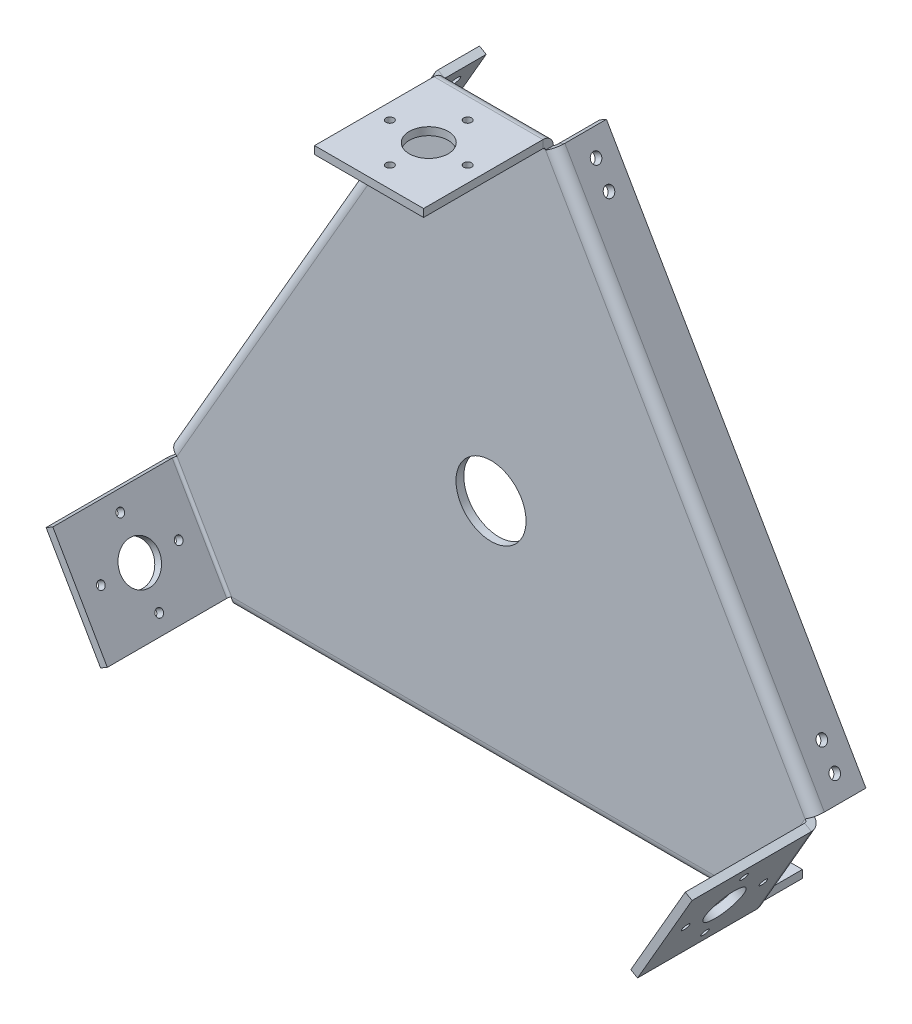
from build123d import *

# Parameters (mm, degrees)
SM_BASE_FLANGE_3_DEPTH        = 3
SM_EDGE_FLANGE_2_DEPTH        = 42
SM_EDGE_FLANGE_2_BEND_DEPTH   = 42
SM_EDGE_FLANGE_2_BEND_2_DEPTH = 42
SM_EDGE_FLANGE_6_DEPTH        = 200
SM_EDGE_FLANGE_6_BEND_DEPTH   = 200
SM_EDGE_FLANGE_6_BEND_2_DEPTH = 200
CUT_EXTRUDE_3_REACH           = 318.122
SKETCH_42_R                   = 7.5
SKETCH_42_R_2                 = 1.5
CUT_EXTRUDE_2_REACH           = 355.809
SKETCH_43_R                   = 7.5
SKETCH_43_R_2                 = 1.5
CUT_EXTRUDE_1_REACH           = 319.229
SKETCH_44_R                   = 7.5
SKETCH_44_R_2                 = 1.5
CUT_EXTRUDE_4_REACH           = 328.974
SKETCH_47_R                   = 2
CUT_EXTRUDE_6_REACH           = 243.544
SKETCH_50_R                   = 2
CUT_EXTRUDE_7_REACH           = 318.122
SKETCH_51_R                   = 2
CUT_EXTRUDE_8_REACH           = 315.847
SKETCH_52_R                   = 13.5


# Sheet-metal steps are written as plain solids
with BuildPart() as part:
    # Эскиз10 → Базовая кромка3 (new body)
    with BuildSketch(Plane.XY):
        Polygon((0, 0), (-21, 36.373066959), (79, 209.578147716), (121, 209.578147716), (221, 36.373066959), (200, 0), align=None)
    extrude(amount=-SM_BASE_FLANGE_3_DEPTH)

    # Ребро-кромка2 section (across the edge) → Ребро-кромка2 (add)
    with BuildSketch(Plane(origin=(121, 210.578147716, 0), x_dir=(0, -1, 0), z_dir=(-1, 0, 0))):
        with BuildLine():
            Line((-3, 1), (-3, 47))
            Line((-3, 47), (0, 47))
            Line((0, 47), (0, 1))
            ThreePointArc((0, 1), (0.292893219, 0.292893219), (1, 0))
            Line((1, 0), (1, -3))
            ThreePointArc((1, -3), (-1.828427125, -1.828427125), (-3, 1))
        make_face()
    extrude(amount=SM_EDGE_FLANGE_2_DEPTH)

    # Ребро-кромка2 section 2 (across the edge) → Ребро-кромка2 bend (add)
    with BuildSketch(Plane(origin=(-21.866025404, 35.873066959, 0), x_dir=(0.8660254037844359, 0.5000000000000049, 3.4914813388431326e-15), z_dir=(0.5000000000000049, -0.8660254037844359, 0))):
        with BuildLine():
            Line((-3, 1), (-3, 47))
            Line((-3, 47), (0, 47))
            Line((0, 47), (0, 1))
            ThreePointArc((0, 1), (0.292893219, 0.292893219), (1, 0))
            Line((1, 0), (1, -3))
            ThreePointArc((1, -3), (-1.828427125, -1.828427125), (-3, 1))
        make_face()
    extrude(amount=SM_EDGE_FLANGE_2_BEND_DEPTH)

    # Ребро-кромка2 section 3 (across the edge) → Ребро-кромка2 bend 2 (add)
    with BuildSketch(Plane(origin=(200.866025404, -0.5, 0), x_dir=(-0.8660254037844527, 0.49999999999997596, 3.4914813388431334e-15), z_dir=(0.49999999999997596, 0.8660254037844527, 0))):
        with BuildLine():
            Line((-3, 1), (-3, 47))
            Line((-3, 47), (0, 47))
            Line((0, 47), (0, 1))
            ThreePointArc((0, 1), (0.292893219, 0.292893219), (1, 0))
            Line((1, 0), (1, -3))
            ThreePointArc((1, -3), (-1.828427125, -1.828427125), (-3, 1))
        make_face()
    extrude(amount=SM_EDGE_FLANGE_2_BEND_2_DEPTH)

    # Ребро-кромка6 section (across the edge) → Ребро-кромка6 (add)
    with BuildSketch(Plane(origin=(-21.866025404, 36.873066959, -3), x_dir=(0.8660254037844431, -0.4999999999999925, -3.4914813388431334e-15), z_dir=(0.4999999999999925, 0.8660254037844431, 0))):
        with BuildLine():
            Line((-3, 1), (-3, 17))
            Line((-3, 17), (0, 17))
            Line((0, 17), (0, 1))
            ThreePointArc((0, 1), (0.292893219, 0.292893219), (1, 0))
            Line((1, 0), (1, -3))
            ThreePointArc((1, -3), (-1.828427125, -1.828427125), (-3, 1))
        make_face()
    extrude(amount=SM_EDGE_FLANGE_6_DEPTH)

    # Ребро-кромка6 section 2 (across the edge) → Ребро-кромка6 bend (add)
    with BuildSketch(Plane(origin=(121.866025404, 210.078147716, -3), x_dir=(-0.8660254037844359, -0.5000000000000047, -3.4914813388431334e-15), z_dir=(0.5000000000000047, -0.8660254037844359, 0))):
        with BuildLine():
            Line((-3, 1), (-3, 17))
            Line((-3, 17), (0, 17))
            Line((0, 17), (0, 1))
            ThreePointArc((0, 1), (0.292893219, 0.292893219), (1, 0))
            Line((1, 0), (1, -3))
            ThreePointArc((1, -3), (-1.828427125, -1.828427125), (-3, 1))
        make_face()
    extrude(amount=SM_EDGE_FLANGE_6_BEND_DEPTH)

    # Ребро-кромка6 section 3 (across the edge) → Ребро-кромка6 bend 2 (add)
    with BuildSketch(Plane(origin=(200, -1, -3), x_dir=(0, 1, 0), z_dir=(-1, 0, 0))):
        with BuildLine():
            Line((-3, 1), (-3, 17))
            Line((-3, 17), (0, 17))
            Line((0, 17), (0, 1))
            ThreePointArc((0, 1), (0.292893219, 0.292893219), (1, 0))
            Line((1, 0), (1, -3))
            ThreePointArc((1, -3), (-1.828427125, -1.828427125), (-3, 1))
        make_face()
    extrude(amount=SM_EDGE_FLANGE_6_BEND_2_DEPTH)

    # Эскиз42 → Вырез-Вытянуть3 (cut, up to next)
    with BuildSketch(Plane(origin=(0, 213.578147716, 0), x_dir=(1, 0, 0), z_dir=(0, 1, 0)), mode=Mode.PRIVATE) as cut_extrude_3_sk1:
        with Locations(Location((100, -24, 0), (0, 0, 180))):
            Circle(SKETCH_42_R)
    cut_extrude_3_tool1 = extrude(cut_extrude_3_sk1.sketch, amount=-CUT_EXTRUDE_3_REACH, mode=Mode.PRIVATE) & part.part
    # Эскиз42 → Вырез-Вытянуть3 (cut, up to next)
    with BuildSketch(Plane(origin=(0, 213.578147716, 0), x_dir=(1, 0, 0), z_dir=(0, 1, 0)), mode=Mode.PRIVATE) as cut_extrude_3_sk2:
        with Locations(Location((100, -9, 0), (0, 0, 180))):
            Circle(SKETCH_42_R_2)
    cut_extrude_3_tool2 = extrude(cut_extrude_3_sk2.sketch, amount=-CUT_EXTRUDE_3_REACH, mode=Mode.PRIVATE) & part.part
    # Эскиз42 → Вырез-Вытянуть3 (cut, up to next)
    with BuildSketch(Plane(origin=(0, 213.578147716, 0), x_dir=(1, 0, 0), z_dir=(0, 1, 0)), mode=Mode.PRIVATE) as cut_extrude_3_sk3:
        with Locations(Location((115, -24, 0), (0, 0, 180))):
            Circle(SKETCH_42_R_2)
    cut_extrude_3_tool3 = extrude(cut_extrude_3_sk3.sketch, amount=-CUT_EXTRUDE_3_REACH, mode=Mode.PRIVATE) & part.part
    # Эскиз42 → Вырез-Вытянуть3 (cut, up to next)
    with BuildSketch(Plane(origin=(0, 213.578147716, 0), x_dir=(1, 0, 0), z_dir=(0, 1, 0)), mode=Mode.PRIVATE) as cut_extrude_3_sk4:
        with Locations(Location((100, -39, 0), (0, 0, 180))):
            Circle(SKETCH_42_R_2)
    cut_extrude_3_tool4 = extrude(cut_extrude_3_sk4.sketch, amount=-CUT_EXTRUDE_3_REACH, mode=Mode.PRIVATE) & part.part
    # Эскиз42 → Вырез-Вытянуть3 (cut, up to next)
    with BuildSketch(Plane(origin=(0, 213.578147716, 0), x_dir=(1, 0, 0), z_dir=(0, 1, 0)), mode=Mode.PRIVATE) as cut_extrude_3_sk5:
        with Locations(Location((85, -24, 0), (0, 0, 180))):
            Circle(SKETCH_42_R_2)
    cut_extrude_3_tool5 = extrude(cut_extrude_3_sk5.sketch, amount=-CUT_EXTRUDE_3_REACH, mode=Mode.PRIVATE) & part.part
    add(cut_extrude_3_tool1.solids().sort_by_distance((100, 213.578148, 24))[0], mode=Mode.SUBTRACT)
    add(cut_extrude_3_tool2.solids().sort_by_distance((100, 213.578148, 9))[0], mode=Mode.SUBTRACT)
    add(cut_extrude_3_tool3.solids().sort_by_distance((115, 213.578148, 24))[0], mode=Mode.SUBTRACT)
    add(cut_extrude_3_tool4.solids().sort_by_distance((100, 213.578148, 39))[0], mode=Mode.SUBTRACT)
    add(cut_extrude_3_tool5.solids().sort_by_distance((85, 213.578148, 24))[0], mode=Mode.SUBTRACT)

    # Эскиз43 → Вырез-Вытянуть2 (cut, up to next)
    with BuildSketch(Plane(origin=(153.464101615, -88.602540378, 0), x_dir=(0, 0, -1), z_dir=(0.8660254037844525, -0.4999999999999761, -3.3549385599670306e-15)), mode=Mode.PRIVATE) as cut_extrude_2_sk1:
        with Locations(Location((-24, 121, 0), (0, 0, 90))):
            Circle(SKETCH_43_R)
    cut_extrude_2_tool1 = extrude(cut_extrude_2_sk1.sketch, amount=-CUT_EXTRUDE_2_REACH, mode=Mode.PRIVATE) & part.part
    # Эскиз43 → Вырез-Вытянуть2 (cut, up to next)
    with BuildSketch(Plane(origin=(153.464101615, -88.602540378, 0), x_dir=(0, 0, -1), z_dir=(0.8660254037844525, -0.4999999999999761, -3.3549385599670306e-15)), mode=Mode.PRIVATE) as cut_extrude_2_sk2:
        with Locations(Location((-24, 136, 0), (0, 0, 90))):
            Circle(SKETCH_43_R_2)
    cut_extrude_2_tool2 = extrude(cut_extrude_2_sk2.sketch, amount=-CUT_EXTRUDE_2_REACH, mode=Mode.PRIVATE) & part.part
    # Эскиз43 → Вырез-Вытянуть2 (cut, up to next)
    with BuildSketch(Plane(origin=(153.464101615, -88.602540378, 0), x_dir=(0, 0, -1), z_dir=(0.8660254037844525, -0.4999999999999761, -3.3549385599670306e-15)), mode=Mode.PRIVATE) as cut_extrude_2_sk3:
        with Locations(Location((-9, 121, 0), (0, 0, 90))):
            Circle(SKETCH_43_R_2)
    cut_extrude_2_tool3 = extrude(cut_extrude_2_sk3.sketch, amount=-CUT_EXTRUDE_2_REACH, mode=Mode.PRIVATE) & part.part
    # Эскиз43 → Вырез-Вытянуть2 (cut, up to next)
    with BuildSketch(Plane(origin=(153.464101615, -88.602540378, 0), x_dir=(0, 0, -1), z_dir=(0.8660254037844525, -0.4999999999999761, -3.3549385599670306e-15)), mode=Mode.PRIVATE) as cut_extrude_2_sk4:
        with Locations(Location((-24, 106, 0), (0, 0, 90))):
            Circle(SKETCH_43_R_2)
    cut_extrude_2_tool4 = extrude(cut_extrude_2_sk4.sketch, amount=-CUT_EXTRUDE_2_REACH, mode=Mode.PRIVATE) & part.part
    # Эскиз43 → Вырез-Вытянуть2 (cut, up to next)
    with BuildSketch(Plane(origin=(153.464101615, -88.602540378, 0), x_dir=(0, 0, -1), z_dir=(0.8660254037844525, -0.4999999999999761, -3.3549385599670306e-15)), mode=Mode.PRIVATE) as cut_extrude_2_sk5:
        with Locations(Location((-39, 121, 0), (0, 0, 90))):
            Circle(SKETCH_43_R_2)
    cut_extrude_2_tool5 = extrude(cut_extrude_2_sk5.sketch, amount=-CUT_EXTRUDE_2_REACH, mode=Mode.PRIVATE) & part.part
    add(cut_extrude_2_tool1.solids().sort_by_distance((213.964102, 16.186533, 24))[0], mode=Mode.SUBTRACT)
    add(cut_extrude_2_tool2.solids().sort_by_distance((221.464102, 29.176915, 24))[0], mode=Mode.SUBTRACT)
    add(cut_extrude_2_tool3.solids().sort_by_distance((213.964102, 16.186533, 9))[0], mode=Mode.SUBTRACT)
    add(cut_extrude_2_tool4.solids().sort_by_distance((206.464102, 3.196152, 24))[0], mode=Mode.SUBTRACT)
    add(cut_extrude_2_tool5.solids().sort_by_distance((213.964102, 16.186533, 39))[0], mode=Mode.SUBTRACT)

    # Эскиз44 → Вырез-Вытянуть1 (cut, up to next)
    with BuildSketch(Plane(origin=(-3.464101615, -2, 0), x_dir=(0, 0, 1), z_dir=(-0.8660254037844358, -0.500000000000005, -3.509022108555461e-15)), mode=Mode.PRIVATE) as cut_extrude_1_sk1:
        with Locations(Location((24, 21, 0), (0, 0, 270))):
            Circle(SKETCH_44_R)
    cut_extrude_1_tool1 = extrude(cut_extrude_1_sk1.sketch, amount=-CUT_EXTRUDE_1_REACH, mode=Mode.PRIVATE) & part.part
    # Эскиз44 → Вырез-Вытянуть1 (cut, up to next)
    with BuildSketch(Plane(origin=(-3.464101615, -2, 0), x_dir=(0, 0, 1), z_dir=(-0.8660254037844358, -0.500000000000005, -3.509022108555461e-15)), mode=Mode.PRIVATE) as cut_extrude_1_sk2:
        with Locations(Location((24, 36, 0), (0, 0, 270))):
            Circle(SKETCH_44_R_2)
    cut_extrude_1_tool2 = extrude(cut_extrude_1_sk2.sketch, amount=-CUT_EXTRUDE_1_REACH, mode=Mode.PRIVATE) & part.part
    # Эскиз44 → Вырез-Вытянуть1 (cut, up to next)
    with BuildSketch(Plane(origin=(-3.464101615, -2, 0), x_dir=(0, 0, 1), z_dir=(-0.8660254037844358, -0.500000000000005, -3.509022108555461e-15)), mode=Mode.PRIVATE) as cut_extrude_1_sk3:
        with Locations(Location((39, 21, 0), (0, 0, 270))):
            Circle(SKETCH_44_R_2)
    cut_extrude_1_tool3 = extrude(cut_extrude_1_sk3.sketch, amount=-CUT_EXTRUDE_1_REACH, mode=Mode.PRIVATE) & part.part
    # Эскиз44 → Вырез-Вытянуть1 (cut, up to next)
    with BuildSketch(Plane(origin=(-3.464101615, -2, 0), x_dir=(0, 0, 1), z_dir=(-0.8660254037844358, -0.500000000000005, -3.509022108555461e-15)), mode=Mode.PRIVATE) as cut_extrude_1_sk4:
        with Locations(Location((24, 6, 0), (0, 0, 270))):
            Circle(SKETCH_44_R_2)
    cut_extrude_1_tool4 = extrude(cut_extrude_1_sk4.sketch, amount=-CUT_EXTRUDE_1_REACH, mode=Mode.PRIVATE) & part.part
    # Эскиз44 → Вырез-Вытянуть1 (cut, up to next)
    with BuildSketch(Plane(origin=(-3.464101615, -2, 0), x_dir=(0, 0, 1), z_dir=(-0.8660254037844358, -0.500000000000005, -3.509022108555461e-15)), mode=Mode.PRIVATE) as cut_extrude_1_sk5:
        with Locations(Location((9, 21, 0), (0, 0, 270))):
            Circle(SKETCH_44_R_2)
    cut_extrude_1_tool5 = extrude(cut_extrude_1_sk5.sketch, amount=-CUT_EXTRUDE_1_REACH, mode=Mode.PRIVATE) & part.part
    add(cut_extrude_1_tool1.solids().sort_by_distance((-13.964102, 16.186533, 24))[0], mode=Mode.SUBTRACT)
    add(cut_extrude_1_tool2.solids().sort_by_distance((-21.464102, 29.176915, 24))[0], mode=Mode.SUBTRACT)
    add(cut_extrude_1_tool3.solids().sort_by_distance((-13.964102, 16.186533, 39))[0], mode=Mode.SUBTRACT)
    add(cut_extrude_1_tool4.solids().sort_by_distance((-6.464102, 3.196152, 24))[0], mode=Mode.SUBTRACT)
    add(cut_extrude_1_tool5.solids().sort_by_distance((-13.964102, 16.186533, 9))[0], mode=Mode.SUBTRACT)

    # Эскиз47 → Вырез-Вытянуть4 (cut, up to next)
    with BuildSketch(Plane(origin=(-34.964101615, 20.186533479, 0), x_dir=(0, 0, 1), z_dir=(-0.866025403784443, 0.4999999999999925, 3.788649256556814e-15)), mode=Mode.PRIVATE) as cut_extrude_4_sk1:
        with Locations(Location((-12, 29, 0), (0, 0, 270))):
            Circle(SKETCH_47_R)
    cut_extrude_4_tool1 = extrude(cut_extrude_4_sk1.sketch, amount=-CUT_EXTRUDE_4_REACH, mode=Mode.PRIVATE) & part.part
    # Эскиз47 → Вырез-Вытянуть4 (cut, up to next)
    with BuildSketch(Plane(origin=(-34.964101615, 20.186533479, 0), x_dir=(0, 0, 1), z_dir=(-0.866025403784443, 0.4999999999999925, 3.788649256556814e-15)), mode=Mode.PRIVATE) as cut_extrude_4_sk2:
        with Locations(Location((-12, 39, 0), (0, 0, 270))):
            Circle(SKETCH_47_R)
    cut_extrude_4_tool2 = extrude(cut_extrude_4_sk2.sketch, amount=-CUT_EXTRUDE_4_REACH, mode=Mode.PRIVATE) & part.part
    # Эскиз47 → Вырез-Вытянуть4 (cut, up to next)
    with BuildSketch(Plane(origin=(-34.964101615, 20.186533479, 0), x_dir=(0, 0, 1), z_dir=(-0.866025403784443, 0.4999999999999925, 3.788649256556814e-15)), mode=Mode.PRIVATE) as cut_extrude_4_sk3:
        with Locations(Location((-12, 203, 0), (0, 0, 270))):
            Circle(SKETCH_47_R)
    cut_extrude_4_tool3 = extrude(cut_extrude_4_sk3.sketch, amount=-CUT_EXTRUDE_4_REACH, mode=Mode.PRIVATE) & part.part
    # Эскиз47 → Вырез-Вытянуть4 (cut, up to next)
    with BuildSketch(Plane(origin=(-34.964101615, 20.186533479, 0), x_dir=(0, 0, 1), z_dir=(-0.866025403784443, 0.4999999999999925, 3.788649256556814e-15)), mode=Mode.PRIVATE) as cut_extrude_4_sk4:
        with Locations(Location((-12, 213, 0), (0, 0, 270))):
            Circle(SKETCH_47_R)
    cut_extrude_4_tool4 = extrude(cut_extrude_4_sk4.sketch, amount=-CUT_EXTRUDE_4_REACH, mode=Mode.PRIVATE) & part.part
    add(cut_extrude_4_tool1.solids().sort_by_distance((-20.464102, 45.30127, -12))[0], mode=Mode.SUBTRACT)
    add(cut_extrude_4_tool2.solids().sort_by_distance((-15.464102, 53.961524, -12))[0], mode=Mode.SUBTRACT)
    add(cut_extrude_4_tool3.solids().sort_by_distance((66.535898, 195.98969, -12))[0], mode=Mode.SUBTRACT)
    add(cut_extrude_4_tool4.solids().sort_by_distance((71.535898, 204.649944, -12))[0], mode=Mode.SUBTRACT)

    # Эскиз50 → Вырез-Вытянуть6 (cut, up to next)
    with BuildSketch(Plane(origin=(184.964101615, 106.789073858, 0), x_dir=(0, 0, -1), z_dir=(0.866025403784436, 0.5000000000000047, 3.0623287353932815e-15)), mode=Mode.PRIVATE) as cut_extrude_6_sk1:
        with Locations(Location((12, -71, 0), (0, 0, 90))):
            Circle(SKETCH_50_R)
    cut_extrude_6_tool1 = extrude(cut_extrude_6_sk1.sketch, amount=-CUT_EXTRUDE_6_REACH, mode=Mode.PRIVATE) & part.part
    # Эскиз50 → Вырез-Вытянуть6 (cut, up to next)
    with BuildSketch(Plane(origin=(184.964101615, 106.789073858, 0), x_dir=(0, 0, -1), z_dir=(0.866025403784436, 0.5000000000000047, 3.0623287353932815e-15)), mode=Mode.PRIVATE) as cut_extrude_6_sk2:
        with Locations(Location((12, -61, 0), (0, 0, 90))):
            Circle(SKETCH_50_R)
    cut_extrude_6_tool2 = extrude(cut_extrude_6_sk2.sketch, amount=-CUT_EXTRUDE_6_REACH, mode=Mode.PRIVATE) & part.part
    # Эскиз50 → Вырез-Вытянуть6 (cut, up to next)
    with BuildSketch(Plane(origin=(184.964101615, 106.789073858, 0), x_dir=(0, 0, -1), z_dir=(0.866025403784436, 0.5000000000000047, 3.0623287353932815e-15)), mode=Mode.PRIVATE) as cut_extrude_6_sk3:
        with Locations(Location((12, 103, 0), (0, 0, 90))):
            Circle(SKETCH_50_R)
    cut_extrude_6_tool3 = extrude(cut_extrude_6_sk3.sketch, amount=-CUT_EXTRUDE_6_REACH, mode=Mode.PRIVATE) & part.part
    # Эскиз50 → Вырез-Вытянуть6 (cut, up to next)
    with BuildSketch(Plane(origin=(184.964101615, 106.789073858, 0), x_dir=(0, 0, -1), z_dir=(0.866025403784436, 0.5000000000000047, 3.0623287353932815e-15)), mode=Mode.PRIVATE) as cut_extrude_6_sk4:
        with Locations(Location((12, 113, 0), (0, 0, 90))):
            Circle(SKETCH_50_R)
    cut_extrude_6_tool4 = extrude(cut_extrude_6_sk4.sketch, amount=-CUT_EXTRUDE_6_REACH, mode=Mode.PRIVATE) & part.part
    add(cut_extrude_6_tool1.solids().sort_by_distance((220.464102, 45.30127, -12))[0], mode=Mode.SUBTRACT)
    add(cut_extrude_6_tool2.solids().sort_by_distance((215.464102, 53.961524, -12))[0], mode=Mode.SUBTRACT)
    add(cut_extrude_6_tool3.solids().sort_by_distance((133.464102, 195.98969, -12))[0], mode=Mode.SUBTRACT)
    add(cut_extrude_6_tool4.solids().sort_by_distance((128.464102, 204.649944, -12))[0], mode=Mode.SUBTRACT)

    # Эскиз51 → Вырез-Вытянуть7 (cut, up to next)
    with BuildSketch(Plane.XZ.offset(4), mode=Mode.PRIVATE) as cut_extrude_7_sk1:
        with Locations(Location((192, -12, 0), (0, 0, 270))):
            Circle(SKETCH_51_R)
    cut_extrude_7_tool1 = extrude(cut_extrude_7_sk1.sketch, amount=-CUT_EXTRUDE_7_REACH, mode=Mode.PRIVATE) & part.part
    # Эскиз51 → Вырез-Вытянуть7 (cut, up to next)
    with BuildSketch(Plane.XZ.offset(4), mode=Mode.PRIVATE) as cut_extrude_7_sk2:
        with Locations(Location((182, -12, 0), (0, 0, 270))):
            Circle(SKETCH_51_R)
    cut_extrude_7_tool2 = extrude(cut_extrude_7_sk2.sketch, amount=-CUT_EXTRUDE_7_REACH, mode=Mode.PRIVATE) & part.part
    # Эскиз51 → Вырез-Вытянуть7 (cut, up to next)
    with BuildSketch(Plane.XZ.offset(4), mode=Mode.PRIVATE) as cut_extrude_7_sk3:
        with Locations(Location((18, -12, 0), (0, 0, 270))):
            Circle(SKETCH_51_R)
    cut_extrude_7_tool3 = extrude(cut_extrude_7_sk3.sketch, amount=-CUT_EXTRUDE_7_REACH, mode=Mode.PRIVATE) & part.part
    # Эскиз51 → Вырез-Вытянуть7 (cut, up to next)
    with BuildSketch(Plane.XZ.offset(4), mode=Mode.PRIVATE) as cut_extrude_7_sk4:
        with Locations(Location((8, -12, 0), (0, 0, 270))):
            Circle(SKETCH_51_R)
    cut_extrude_7_tool4 = extrude(cut_extrude_7_sk4.sketch, amount=-CUT_EXTRUDE_7_REACH, mode=Mode.PRIVATE) & part.part
    add(cut_extrude_7_tool1.solids().sort_by_distance((192, -4, -12))[0], mode=Mode.SUBTRACT)
    add(cut_extrude_7_tool2.solids().sort_by_distance((182, -4, -12))[0], mode=Mode.SUBTRACT)
    add(cut_extrude_7_tool3.solids().sort_by_distance((18, -4, -12))[0], mode=Mode.SUBTRACT)
    add(cut_extrude_7_tool4.solids().sort_by_distance((8, -4, -12))[0], mode=Mode.SUBTRACT)

    # Эскиз52 → Вырез-Вытянуть8 (cut, up to next)
    with BuildSketch(Plane(origin=(0, 0, -3), x_dir=(-1, 0, 0), z_dir=(0, 0, -1)), mode=Mode.PRIVATE) as cut_extrude_8_sk1:
        with Locations((-100, 81.983738225)):
            Circle(SKETCH_52_R)
    cut_extrude_8_tool1 = extrude(cut_extrude_8_sk1.sketch, amount=-CUT_EXTRUDE_8_REACH, mode=Mode.PRIVATE) & part.part
    add(cut_extrude_8_tool1.solids().sort_by_distance((100, 81.983738, -3))[0], mode=Mode.SUBTRACT)


solid = part.part
